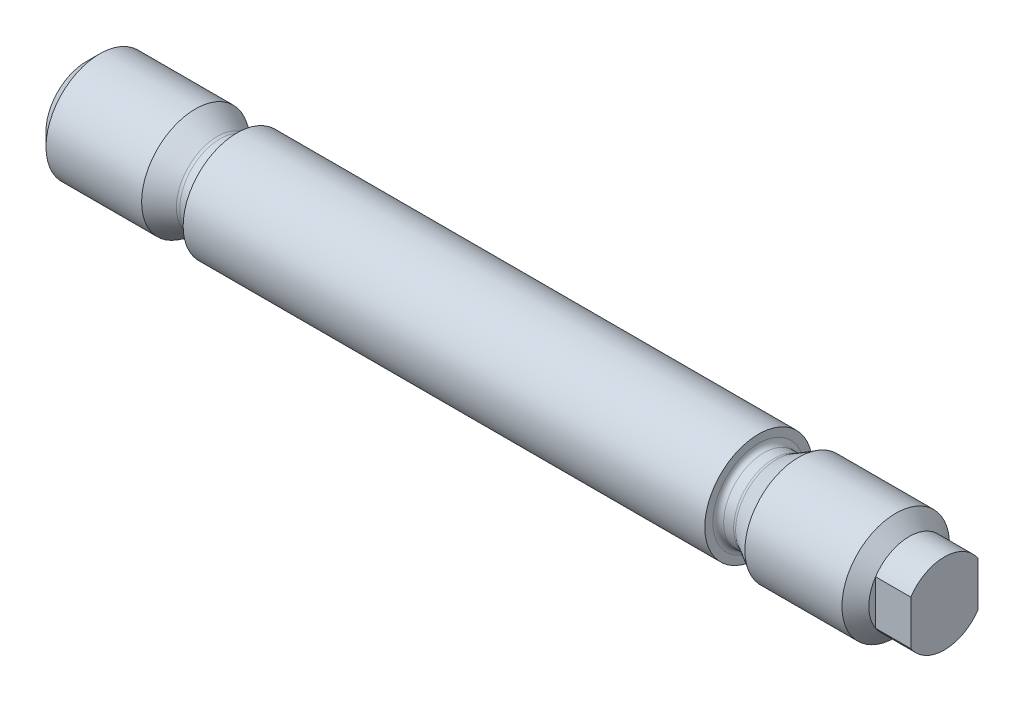
from build123d import *

# Parameters (mm, degrees)
DOGPOINT_DEPTH = 5.24


with BuildPart() as part:
    # BodySke → BaseBody (revolve)
    with BuildSketch(Plane.XY):
        with BuildLine():
            Line((19.5, 6.107179677), (16.221539031, 8))
            Line((16.221539031, 8), (2, 8))
            Line((2, 8), (0, 6))
            Line((0, 6), (0, 0))
            Line((0, 0), (122.4, 0))
            Line((122.4, 0), (122.4, 6))
            Line((122.4, 6), (120.4, 8))
            Line((120.4, 8), (105.964101615, 8))
            Line((105.964101615, 8), (102.685640646, 6.107179677))
            ThreePointArc((102.685640646, 6.107179677), (102.492695882, 6.027259339), (102.285640646, 6))
            Line((102.285640646, 6), (100.8, 6))
            ThreePointArc((100.8, 6), (100.234314575, 6.234314575), (100, 6.8))
            Line((100, 6.8), (100, 8))
            Line((100, 8), (22.4, 8))
            Line((22.4, 8), (22.4, 6.8))
            ThreePointArc((22.4, 6.8), (22.165685425, 6.234314575), (21.6, 6))
            Line((21.6, 6), (19.9, 6))
            ThreePointArc((19.9, 6), (19.692944764, 6.027259339), (19.5, 6.107179677))
        make_face()
    revolve(axis=Axis((-3.175, 0, 0), (1, 0, 0)))

    # DogPointSke → DogPoint (add)
    with BuildSketch(Plane(origin=(122.4, 0, 0), x_dir=(0, 0, -1), z_dir=(1, 0, 0))):
        with BuildLine():
            Line((-5, 3.31662479), (-5, -3.31662479))
            ThreePointArc((-5, -3.31662479), (0, -6), (5, -3.31662479))
            Line((5, -3.31662479), (5, 3.31662479))
            ThreePointArc((5, 3.31662479), (0, 6), (-5, 3.31662479))
        make_face()
    extrude(amount=DOGPOINT_DEPTH)


solid = part.part
